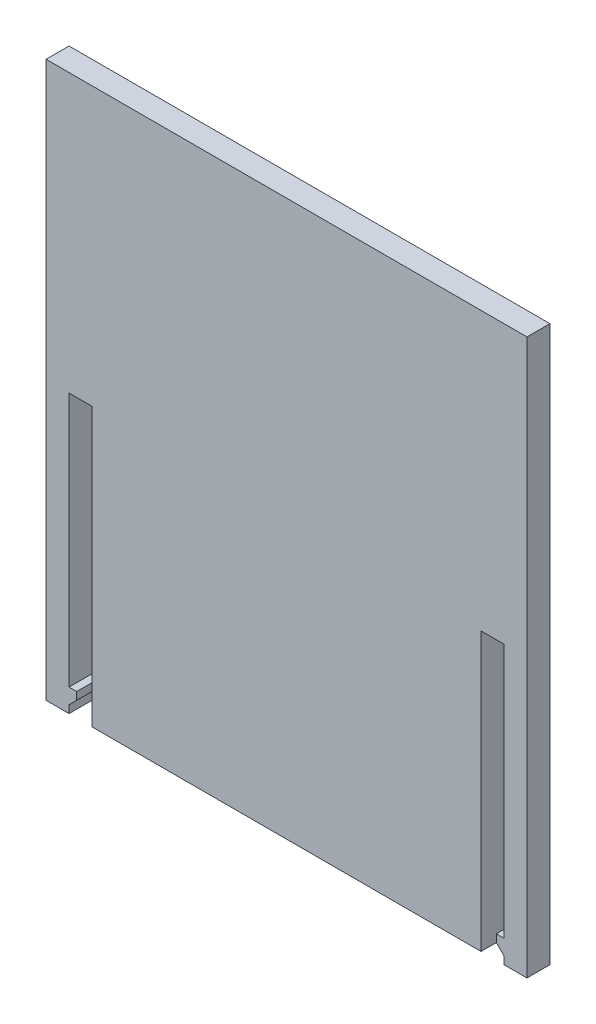
from build123d import *

# Parameters (mm, degrees)
SKETCH1_W           = 62.8
SKETCH1_H           = 72.5
SKETCH1_W_2         = 3
SKETCH1_H_2         = 33.25
BOSS_EXTRUDE1_DEPTH = 3
CUT_EXTRUDE1_DEPTH  = 82.696898787


with BuildPart() as part:
    # Sketch1 → Boss-Extrude1 (new body)
    with BuildSketch(Plane.XY):
        with Locations((25.4, 22.394209189)):
            Rectangle(SKETCH1_W, SKETCH1_H)
        with Locations((-1.5, 5.769209189)):
            Rectangle(SKETCH1_W_2, SKETCH1_H_2, mode=Mode.SUBTRACT)
        with Locations((52.3, 5.769209189)):
            Rectangle(SKETCH1_W_2, SKETCH1_H_2, mode=Mode.SUBTRACT)
    extrude(amount=BOSS_EXTRUDE1_DEPTH)

    # Sketch2 → Cut-Extrude1 (cut, through all)
    with BuildSketch(Plane.XY.offset(3)):
        Polygon((0, -10.855790811), (-2, -10.855790811), (-2, -11.855790811), (-3, -12.855790811), (-3, -13.855790811), (0, -13.855790811), align=None)
    cut_extrude1 = extrude(amount=-CUT_EXTRUDE1_DEPTH, mode=Mode.SUBTRACT)

    # Mirror1: Cut-Extrude1 across plane
    add(cut_extrude1.mirror(Plane.ZY.offset(-25.4)), mode=Mode.SUBTRACT)


solid = part.part
